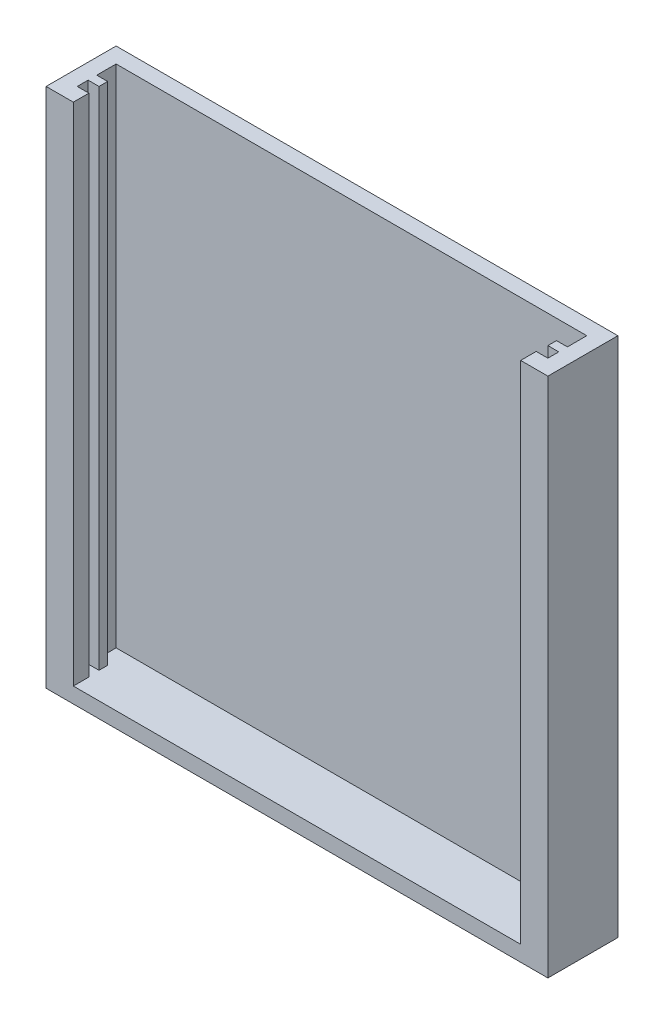
from build123d import *

# Parameters (mm, degrees)
BOSS_EXTRUDE1_DEPTH = 65
SKETCH9_W           = 64.5
SKETCH9_H           = 9
BOSS_EXTRUDE2_DEPTH = 2


with BuildPart() as part:
    # Sketch8 → Boss-Extrude1 (new body)
    with BuildSketch(Plane(origin=(0, 0, 0), x_dir=(1, 0, 0), z_dir=(0, 1, 0))):
        Polygon((-2.697817866, 0.481305486), (56.864446285, 0.481305486), (56.864446285, -2.009260552), (55.464446285, -2.009260552), (55.464446285, -3.118694514), (56.864446285, -3.118694514), (56.864446285, -4.518694514), (55.364446285, -4.518694514), (55.364446285, -6.518694514), (58.864446285, -6.518694514), (58.864446285, 2.481305486), (-5.635553715, 2.481305486), (-5.635553715, -6.518694514), (-2.135553715, -6.518694514), (-2.135553715, -4.518694514), (-3.635553715, -4.518694514), (-3.635553715, -3.118694514), (-2.235553715, -3.118694514), (-2.235553715, -2.009260552), (-3.635553715, -2.009260552), (-3.635553715, 0.481305486), align=None)
    extrude(amount=BOSS_EXTRUDE1_DEPTH)

    # Sketch9 → Boss-Extrude2 (add)
    with BuildSketch(Plane.XZ):
        with Locations((26.614446285, 2.018694514)):
            Rectangle(SKETCH9_W, SKETCH9_H)
    extrude(amount=BOSS_EXTRUDE2_DEPTH)


solid = part.part
